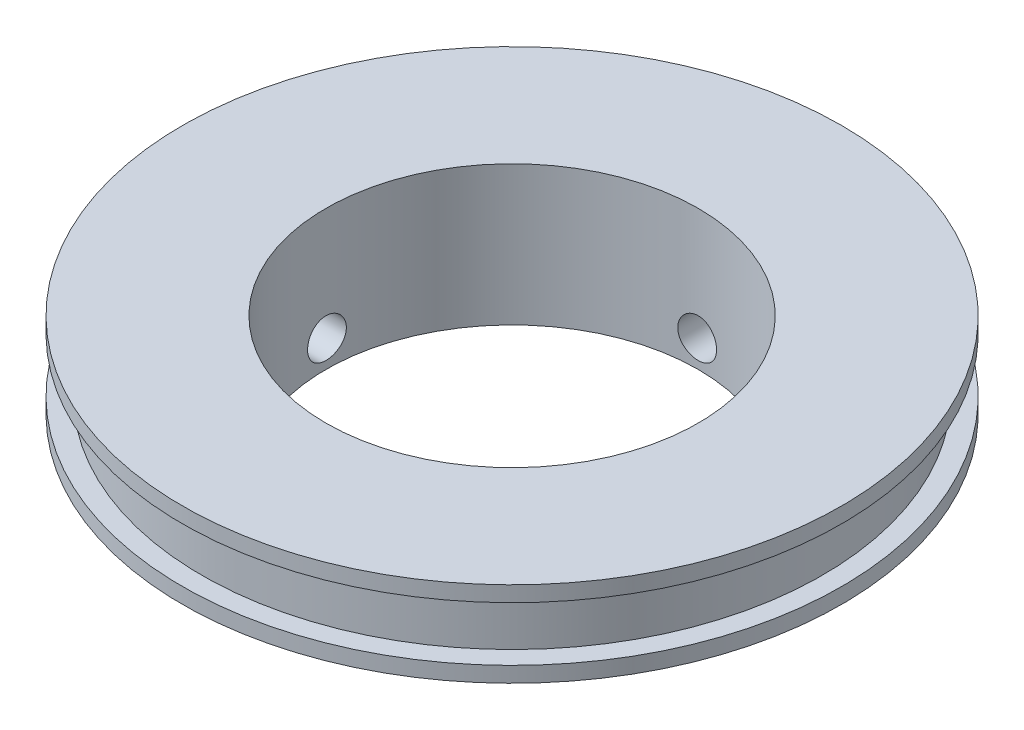
from build123d import *

# Parameters (mm, degrees)
SKETCH2_R          = 2.5
CUT_EXTRUDE1_DEPTH = 62.260968549
SKETCH3_R          = 2.5
CUT_EXTRUDE2_DEPTH = 62.260968569


with BuildPart() as part:
    # Sketch1 → Revolve1 (revolve)
    with BuildSketch(Plane.XY):
        Polygon((24, 6.150684932), (42.5, 6.150684932), (42.5, 4.150684932), (40, 4.150684932), (40, -2.849315068), (42.5, -2.849315068), (42.5, -4.849315068), (30, -4.849315068), (30, -11.849315068), (24, -11.849315068), align=None)
    revolve(axis=Axis((0, 0, 0), (0, 1, 0)))

    # Sketch2 → Cut-Extrude1 (cut, through all)
    with BuildSketch(Plane.XY):
        with Locations((0, -8.349315068)):
            Circle(SKETCH2_R)
    extrude(amount=-CUT_EXTRUDE1_DEPTH, mode=Mode.SUBTRACT)

    # Sketch3 → Cut-Extrude2 (cut, through all)
    with BuildSketch(Plane(origin=(0, 0, 0), x_dir=(0, 0, -1), z_dir=(1, 0, 0))):
        with Locations((0, -8.349315068)):
            Circle(SKETCH3_R)
    extrude(amount=-CUT_EXTRUDE2_DEPTH, mode=Mode.SUBTRACT)


solid = part.part
